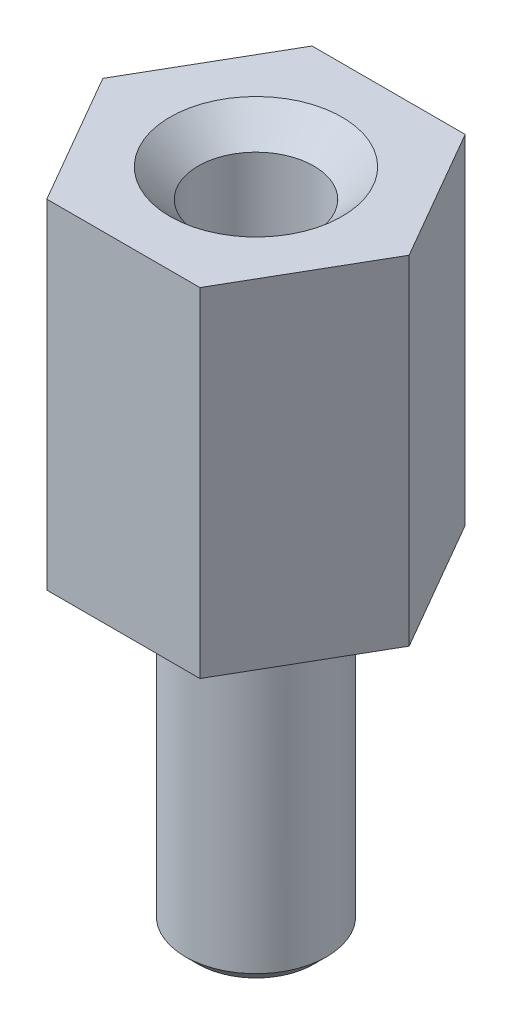
from build123d import *

# Parameters (mm, degrees)
BOSS_EXTRUDE1_DEPTH                = 6
SKETCH2_W                          = 1.25
SKETCH2_H                          = 6
TAP_DRILL_FOR_M2_5X0_45_TAP1_D     = 2.05
TAP_DRILL_FOR_M2_5X0_45_TAP1_DEPTH = 19
CHAMFER1_SIZE                      = 0.5


with BuildPart() as part:
    # Sketch1 → Boss-Extrude1 (new body)
    with BuildSketch(Plane(origin=(0, 6, 0), x_dir=(1, 0, 0), z_dir=(0, 1, 0))):
        Polygon((1.356773133, -2.35), (2.713546265, 0), (1.356773133, 2.35), (-1.356773133, 2.35), (-2.713546265, 0), (-1.356773133, -2.35), align=None)
    extrude(amount=-BOSS_EXTRUDE1_DEPTH)

    # Sketch2 → Revolve1 (revolve)
    with BuildSketch(Plane(origin=(0, 0, 0), x_dir=(-1, 0, 0), z_dir=(0, 0, -1)), mode=Mode.PRIVATE) as revolve1_sk:
        with Locations((-0.625, -3)):
            Rectangle(SKETCH2_W, SKETCH2_H)
    revolve(revolve1_sk.sketch.rotate(Axis((0, -6, 0), (0, 1, 0)), 270), axis=Axis((0, -6, 0), (0, 1, 0)))

    # Tap Drill for M2.5x0.45 Tap1
    with Locations(Plane(origin=(0, 6, 0), x_dir=(1, 0, 0), z_dir=(0, 1, 0))):
        with Locations((0, 0)):
            Hole(TAP_DRILL_FOR_M2_5X0_45_TAP1_D / 2, depth=TAP_DRILL_FOR_M2_5X0_45_TAP1_DEPTH)

    # Chamfer1
    # the kernel refuses this chamfer: 0.5 mm, written as the material it takes off along each edge
    with BuildSketch(Plane(origin=(0, -6, 0), x_dir=(0, 0, 1), z_dir=(-1, 0, 0))) as chamfer1_piece_1:
        Polygon((1.25, CHAMFER1_SIZE), (1.25 - CHAMFER1_SIZE, 0), (1.25, 0), align=None)
    revolve(axis=Axis((0, -6, 0), (0, 1, 0)), mode=Mode.SUBTRACT)
    with BuildSketch(Plane(origin=(0, 6, 0), x_dir=(-1, 0, 0), z_dir=(0, 0, 1))) as chamfer1_piece_2:
        Polygon((1.025 + CHAMFER1_SIZE, 0), (1.025, CHAMFER1_SIZE), (1.025, 0), align=None)
    revolve(axis=Axis((0, 6, 0), (0, -1, 0)), mode=Mode.SUBTRACT)


solid = part.part
